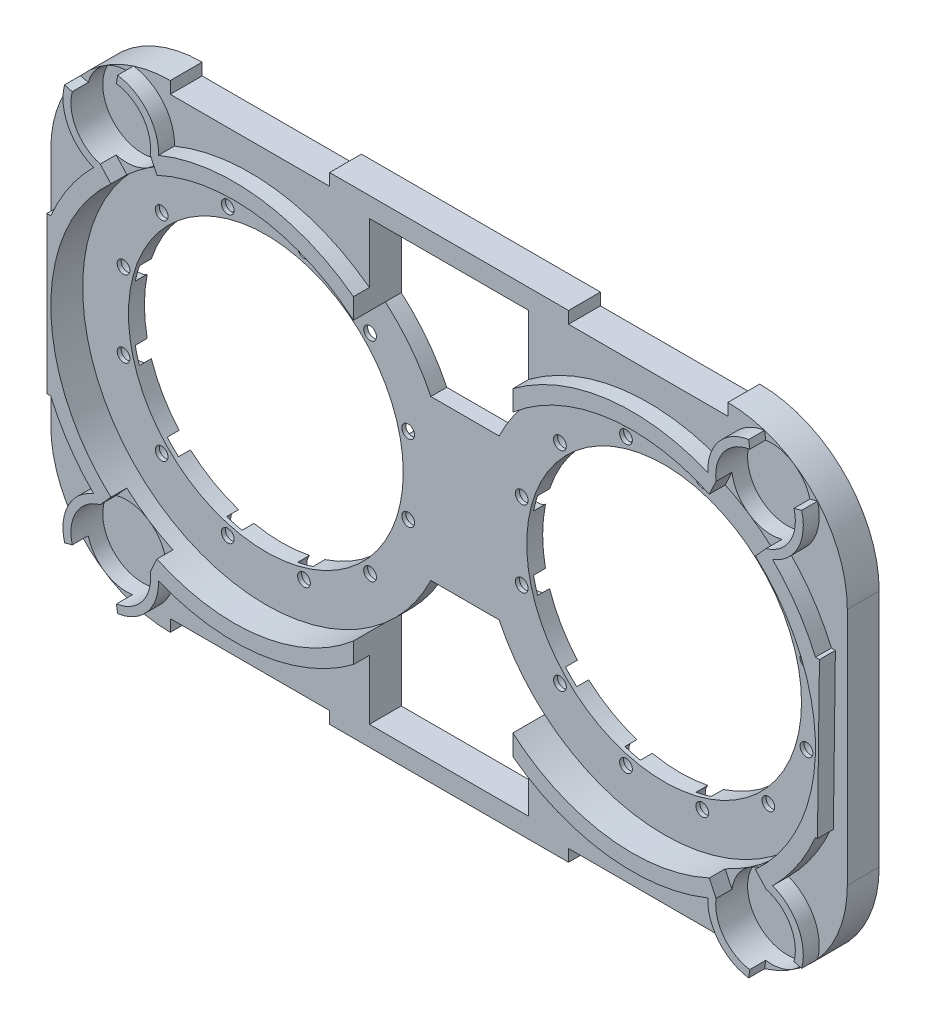
from build123d import *
from build123d.topology import SkipClean

# Parameters (mm, degrees)
SKETCH_1_R                   = 34.5
EXTRUDE_1260_DEPTH           = 4
EXTRUDE_START                = 4
SKETCH_2_R                   = 10
EXTRUDE_1_DEPTH              = 4
CUT_EXTRUDE_1_DEPTH          = 4
CUT_EXTRUDE_1_DEPTH_BACK     = 4
SKETCH_3_W                   = 40
SKETCH_3_H                   = 3
SKETCH_3_H_2                 = 3.124740162
HOLE_WIZARD_M3_2_D           = 3.2
HOLE_WIZARD_M3_2_CBORE_D     = 6.5
HOLE_WIZARD_M3_2_CBORE_DEPTH = 3
EXTRUDE_9_DEPTH              = 4


with BuildPart() as part:
    # 草图1 → Extrude 1260 (new body)
    with BuildSketch(Plane.XY):
        with BuildLine():
            Line((100, -30), (100, 30))
            ThreePointArc((100, 30), (91.213203436, 51.213203436), (70, 60))
            Line((70, 60), (-70, 60))
            ThreePointArc((-70, 60), (-91.213203436, 51.213203436), (-100, 30))
            Line((-100, 30), (-100, -30))
            ThreePointArc((-100, -30), (-91.213203436, -51.213203436), (-70, -60))
            Line((-70, -60), (70, -60))
            ThreePointArc((70, -60), (91.213203436, -51.213203436), (100, -30))
        make_face()
        with BuildLine():
            Line((20, -55), (-20, -55))
            Line((-20, -55), (-20, -34.871191548))
            ThreePointArc((-20, -34.871191548), (-13.521821046, -28.02396225), (-8.575369646, -20))
            Line((-8.575369646, -20), (0, -20))
            Line((0, -20), (8.575369646, -20))
            ThreePointArc((8.575369646, -20), (13.521821046, -28.02396225), (20, -34.871191548))
            Line((20, -34.871191548), (20, -55))
        make_face(mode=Mode.SUBTRACT)
        with Locations((-50, 0)):
            Circle(SKETCH_1_R, mode=Mode.SUBTRACT)
        with Locations((50, 0)):
            Circle(SKETCH_1_R, mode=Mode.SUBTRACT)
        with BuildLine():
            Line((-20, 34.871191548), (-20, 55))
            Line((-20, 55), (20, 55))
            Line((20, 55), (20, 34.871191548))
            ThreePointArc((20, 34.871191548), (13.521821046, 28.02396225), (8.575369646, 20))
            Line((8.575369646, 20), (0, 20))
            Line((0, 20), (-8.575369646, 20))
            ThreePointArc((-8.575369646, 20), (-13.521821046, 28.02396225), (-20, 34.871191548))
        make_face(mode=Mode.SUBTRACT)
    extrude(amount=-EXTRUDE_1260_DEPTH)

    # 草图2 → 凸台-拉伸1 (add)
    with BuildSketch(Plane.XY.offset(EXTRUDE_START)):
        with BuildLine():
            ThreePointArc((-70, 60), (-91.213203436, 51.213203436), (-100, 30))
            Line((-100, 30), (-100, -30))
            ThreePointArc((-100, -30), (-91.213203436, -51.213203436), (-70, -60))
            Line((-70, -60), (70, -60))
            ThreePointArc((70, -60), (91.213203436, -51.213203436), (100, -30))
            Line((100, -30), (100, 30))
            ThreePointArc((100, 30), (91.213203436, 51.213203436), (70, 60))
            Line((70, 60), (-70, 60))
        make_face()
        with Locations((-80.949977087, -46.672125799)):
            Circle(SKETCH_2_R, mode=Mode.SUBTRACT)
        with BuildLine():
            Line((-20, 55), (20, 55))
            Line((20, 55), (20, 34.871191548))
            ThreePointArc((20, 34.871191548), (69.183326093, 41.809089921), (96, 0))
            ThreePointArc((96, 0), (69.183326093, -41.809089921), (20, -34.871191548))
            Line((20, -34.871191548), (20, -55))
            Line((20, -55), (-20, -55))
            Line((-20, -55), (-20, -34.871191548))
            ThreePointArc((-20, -34.871191548), (-96, 0), (-20, 34.871191548))
            Line((-20, 34.871191548), (-20, 55))
        make_face(mode=Mode.SUBTRACT)
        with Locations((80.949977087, -46.672125799)):
            Circle(SKETCH_2_R, mode=Mode.SUBTRACT)
        with Locations((-80.949977087, 46.672125799)):
            Circle(SKETCH_2_R, mode=Mode.SUBTRACT)
        with Locations((80.949977087, 46.672125799)):
            Circle(SKETCH_2_R, mode=Mode.SUBTRACT)
    extrude(amount=-EXTRUDE_1_DEPTH)

    # 草图3 → 切除-拉伸1 (cut, two sides: drawn at the far end of the back side and taken through both)
    with BuildSketch(Plane.XY.offset(-CUT_EXTRUDE_1_DEPTH_BACK)):
        with Locations((-50, -58.5)):
            Rectangle(SKETCH_3_W, SKETCH_3_H)
        with Locations((50, 58.562370081)):
            Rectangle(SKETCH_3_W, SKETCH_3_H_2)
        with Locations((-50, 58.5)):
            Rectangle(SKETCH_3_W, SKETCH_3_H)
        with Locations((50, -58.562370081)):
            Rectangle(SKETCH_3_W, SKETCH_3_H_2)
    extrude(amount=CUT_EXTRUDE_1_DEPTH + CUT_EXTRUDE_1_DEPTH_BACK, mode=Mode.SUBTRACT)

    # M3 六角凹头盖的柱孔2 (through all)
    with Locations(Plane(origin=(76.1629509, 26.1629509, -4), x_dir=(-1, 0, 0), z_dir=(0, 0, -1))):
        with Locations((0, 0), (16.586646231, 9.57630467), (35.739255569, 9.576304673), (52.325901804, 4e-09), (61.902206473, -16.586646231), (61.902206473, -35.739255569), (52.325901804, -52.325901804), (35.739255569, -61.902206473), (-9.57630467, -35.789865232), (-9.57630467, -16.58664623), (16.586646231, -61.902206473), (-4e-09, -52.325901804), (116.586646231, 9.576304673), (135.739255569, 9.576304673), (152.325901804, 4e-09), (161.902206473, -16.586646231), (161.902206473, -35.739255569), (152.325901804, -52.325901804), (135.739255569, -61.902206473), (116.586646231, -61.902206473), (99.999999996, -52.325901804), (90.423695327, -35.739255569), (90.423695327, -16.586646231), (99.999999996, 4e-09)):
            CounterBoreHole(HOLE_WIZARD_M3_2_D / 2, HOLE_WIZARD_M3_2_CBORE_D / 2, HOLE_WIZARD_M3_2_CBORE_DEPTH)

    # 草图7 → 凸台-拉伸9 (add)
    with SkipClean():  # the faces are left unmerged after this step: merging them gives an invalid solid
        with BuildSketch(Plane.XY.offset(4).offset(EXTRUDE_START)):
            with BuildLine():
                Line((-79.222747721, -58.547170166), (-79.510619282, -56.567996105))
                ThreePointArc((-79.510619282, -56.567996105), (-72.973112582, -52.702849858), (-71.036529659, -45.359281519))
                Line((-71.036529659, -45.359281519), (-69.353607287, -41.730538997))
                ThreePointArc((-69.353607287, -41.730538997), (-43.667616459, -45.56205569), (-20, -34.871191548))
                Line((-20, -34.871191548), (-20, -40))
                ThreePointArc((-20, -40), (-43.651226208, -49.595292834), (-68.95681626, -46.267041371))
                ThreePointArc((-68.95681626, -46.267041371), (-71.743312785, -54.368705068), (-79.222747721, -58.547170166))
            make_face()
            with BuildLine():
                Line((-92.533909372, 49.804618866), (-90.603253991, 49.282536688))
                ThreePointArc((-90.603253991, 49.282536688), (-89.631463994, 41.709083881), (-83.59823142, 37.029162095))
                Line((-83.59823142, 37.029162095), (-80.910372906, 34.066829128))
                ThreePointArc((-80.910372906, 34.066829128), (-96, 0), (-80.910372906, -34.066829128))
                Line((-80.910372906, -34.066829128), (-83.59823142, -37.029162095))
                ThreePointArc((-83.59823142, -37.029162095), (-89.631463994, -41.709083881), (-90.603253991, -49.282536688))
                Line((-90.603253991, -49.282536688), (-92.533909372, -49.804618866))
                ThreePointArc((-92.533909372, -49.804618866), (-91.646698387, -41.233361838), (-85.243723779, -35.466603082))
                ThreePointArc((-85.243723779, -35.466603082), (-91.389676552, -28.051642999), (-96, -19.595917942))
                Line((-96, -19.595917942), (-97, -19.595917942))
                Line((-97, -19.595917942), (-97, 19.595917942))
                Line((-97, 19.595917942), (-96, 19.595917942))
                ThreePointArc((-96, 19.595917942), (-91.389676552, 28.051642999), (-85.243723779, 35.466603082))
                ThreePointArc((-85.243723779, 35.466603082), (-91.646698387, 41.233361838), (-92.533909372, 49.804618866))
            make_face()
            with BuildLine():
                Line((-20, 34.871191548), (-20, 40))
                ThreePointArc((-20, 40), (-43.651226208, 49.595292834), (-68.95681626, 46.267041371))
                ThreePointArc((-68.95681626, 46.267041371), (-71.743312785, 54.368705068), (-79.222747721, 58.547170166))
                Line((-79.222747721, 58.547170166), (-79.510619282, 56.567996105))
                ThreePointArc((-79.510619282, 56.567996105), (-72.973112582, 52.702849858), (-71.036529659, 45.359281519))
                Line((-71.036529659, 45.359281519), (-69.353607287, 41.730538997))
                ThreePointArc((-69.353607287, 41.730538997), (-43.667616459, 45.56205569), (-20, 34.871191548))
            make_face()
            with BuildLine():
                Line((79.222747721, 58.547170166), (79.510619282, 56.567996105))
                ThreePointArc((79.510619282, 56.567996105), (72.973112582, 52.702849858), (71.036529659, 45.359281519))
                Line((71.036529659, 45.359281519), (69.353607287, 41.730538997))
                ThreePointArc((69.353607287, 41.730538997), (43.667616459, 45.56205569), (20, 34.871191548))
                Line((20, 34.871191548), (20, 40))
                ThreePointArc((20, 40), (43.651226208, 49.595292834), (68.95681626, 46.267041371))
                ThreePointArc((68.95681626, 46.267041371), (71.743312785, 54.368705068), (79.222747721, 58.547170166))
            make_face()
            with BuildLine():
                Line((83.59823142, 37.029162095), (80.910372906, 34.066829128))
                ThreePointArc((80.910372906, 34.066829128), (96, 0), (80.910372906, -34.066829128))
                Line((80.910372906, -34.066829128), (83.59823142, -37.029162095))
                ThreePointArc((83.59823142, -37.029162095), (89.631463994, -41.709083881), (90.603253991, -49.282536688))
                Line((90.603253991, -49.282536688), (92.533909372, -49.804618866))
                ThreePointArc((92.533909372, -49.804618866), (91.646698387, -41.233361838), (85.243723779, -35.466603082))
                ThreePointArc((85.243723779, -35.466603082), (91.389676552, -28.051642999), (96, -19.595917942))
                Line((96, -19.595917942), (96.5, -19.595917942))
                Line((96.5, -19.595917942), (97, 19.595917942))
                Line((97, 19.595917942), (96, 19.595917942))
                ThreePointArc((96, 19.595917942), (91.389676552, 28.051642999), (85.243723779, 35.466603082))
                ThreePointArc((85.243723779, 35.466603082), (91.646698387, 41.233361838), (92.533909372, 49.804618866))
                Line((92.533909372, 49.804618866), (90.603253991, 49.282536688))
                ThreePointArc((90.603253991, 49.282536688), (89.631463994, 41.709083881), (83.59823142, 37.029162095))
            make_face()
            with BuildLine():
                Line((20, -34.871191548), (20, -40))
                ThreePointArc((20, -40), (43.651226208, -49.595292834), (68.95681626, -46.267041371))
                ThreePointArc((68.95681626, -46.267041371), (71.743312785, -54.368705068), (79.222747721, -58.547170166))
                Line((79.222747721, -58.547170166), (79.510619282, -56.567996105))
                ThreePointArc((79.510619282, -56.567996105), (72.973112582, -52.702849858), (71.036529659, -45.359281519))
                Line((71.036529659, -45.359281519), (69.353607287, -41.730538997))
                ThreePointArc((69.353607287, -41.730538997), (43.667616459, -45.56205569), (20, -34.871191548))
            make_face()
        extrude(amount=-EXTRUDE_9_DEPTH)


solid = part.part
